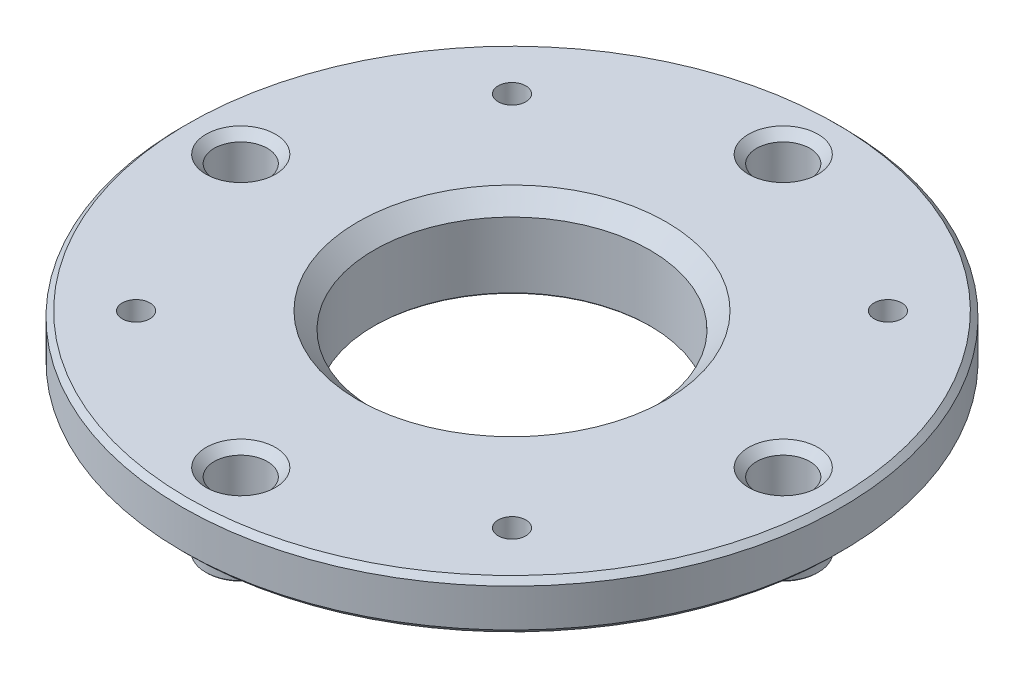
from build123d import *

# Parameters (mm, degrees)
SKETCH1_R                   = 60.75
SKETCH1_R_2                 = 4.9022
SKETCH1_R_3                 = 25.425
BOSS_EXTRUDE1_DEPTH         = 9
BOSS_EXTRUDE2_START         = 6.35
SKETCH2_R                   = 28.485
SKETCH2_R_2                 = 25.425
BOSS_EXTRUDE2_DEPTH         = 6.35
CHAMFER1_SIZE               = 3
CHAMFER2_SIZE               = 1.5
CHAMFER3_SIZE               = 1
BOSS_EXTRUDE3_START         = 4.75
SKETCH3_R                   = 6.475
SKETCH3_R_2                 = 4.9022
BOSS_EXTRUDE3_DEPTH         = 4.75
CHAMFER4_SIZE               = 0.25
TAP_DRILL_FOR_1_4_20_TAP1_D = 5.1054
CHAMFER6_SIZE               = 1


with BuildPart() as part:
    # Sketch1 → Boss-Extrude1 (new body)
    with BuildSketch(Plane(origin=(0, 0, 0), x_dir=(1, 0, 0), z_dir=(0, 1, 0))):
        Circle(SKETCH1_R)
        with Locations((0, 50)):
            Circle(SKETCH1_R_2, mode=Mode.SUBTRACT)
        with Locations((50, 0)):
            Circle(SKETCH1_R_2, mode=Mode.SUBTRACT)
        with Locations((0, -50)):
            Circle(SKETCH1_R_2, mode=Mode.SUBTRACT)
        with Locations((-50, 0)):
            Circle(SKETCH1_R_2, mode=Mode.SUBTRACT)
        Circle(SKETCH1_R_3, mode=Mode.SUBTRACT)
    extrude(amount=BOSS_EXTRUDE1_DEPTH)

    # Sketch2 → Boss-Extrude2 (add)
    with BuildSketch(Plane.XZ.offset(BOSS_EXTRUDE2_START)):
        Circle(SKETCH2_R)
        Circle(SKETCH2_R_2, mode=Mode.SUBTRACT)
    extrude(amount=-BOSS_EXTRUDE2_DEPTH)

    # Chamfer1
    chamfer1_edges = [part.edges().sort_by_distance(p)[0] for p in [
        (-25.425, 9, 0),
    ]]
    chamfer(chamfer1_edges, length=CHAMFER1_SIZE)

    # Chamfer2
    chamfer2_edges = [part.edges().sort_by_distance(p)[0] for p in [
        (-54.9022, 9, 0),
        (-4.9022, 9, 50),
        (45.0978, 9, 0),
        (-4.9022, 9, -50),
    ]]
    chamfer(chamfer2_edges, length=CHAMFER2_SIZE)

    # Chamfer3
    chamfer3_edges = [part.edges().sort_by_distance(p)[0] for p in [
        (-60.75, 9, 0),
        (-60.75, 0, 0),
    ]]
    chamfer(chamfer3_edges, length=CHAMFER3_SIZE)

    # Sketch3 → Boss-Extrude3 (add)
    # profile 1 of 4: a face of its own
    with BuildSketch(Plane.XZ.offset(BOSS_EXTRUDE3_START)):
        with Locations((50, 0)):
            Circle(SKETCH3_R)
        with Locations((50, 0)):
            Circle(SKETCH3_R_2, mode=Mode.SUBTRACT)
    # profile 2 of 4: a face of its own
    with BuildSketch(Plane.XZ.offset(BOSS_EXTRUDE3_START)):
        with Locations((0, -50)):
            Circle(SKETCH3_R)
        with Locations((0, -50)):
            Circle(SKETCH3_R_2, mode=Mode.SUBTRACT)
    # profile 3 of 4: a face of its own
    with BuildSketch(Plane.XZ.offset(BOSS_EXTRUDE3_START)):
        with Locations((-50, 0)):
            Circle(SKETCH3_R)
        with Locations((-50, 0)):
            Circle(SKETCH3_R_2, mode=Mode.SUBTRACT)
    # profile 4 of 4: a face of its own
    with BuildSketch(Plane.XZ.offset(BOSS_EXTRUDE3_START)):
        with Locations((0, 50)):
            Circle(SKETCH3_R)
        with Locations((0, 50)):
            Circle(SKETCH3_R_2, mode=Mode.SUBTRACT)
    extrude(amount=-BOSS_EXTRUDE3_DEPTH)

    # Chamfer4
    chamfer4_edges = [part.edges().sort_by_distance(p)[0] for p in [
        (-4.9022, -4.75, 50),
        (-6.475, -4.75, 50),
        (45.0978, -4.75, 0),
        (43.525, -4.75, 0),
        (-4.9022, -4.75, -50),
        (-6.475, -4.75, -50),
        (-54.9022, -4.75, 0),
        (-56.475, -4.75, 0),
        (-25.425, -6.35, 0),
    ]]
    chamfer(chamfer4_edges, length=CHAMFER4_SIZE)

    # Tap Drill for 1/4-20 Tap1 (through all)
    with Locations(Plane(origin=(0, 0, 0), x_dir=(-1, 0, 0), z_dir=(0, -1, 0))):
        with Locations((-34.648232278, -34.648232278), (-34.648232278, 34.648232278), (34.648232278, 34.648232278), (34.648232278, -34.648232278)):
            Hole(TAP_DRILL_FOR_1_4_20_TAP1_D / 2)

    # Chamfer6
    chamfer6_edges = [part.edges().sort_by_distance(p)[0] for p in [
        (-28.485, -6.35, 0),
    ]]
    chamfer(chamfer6_edges, length=CHAMFER6_SIZE)


solid = part.part
